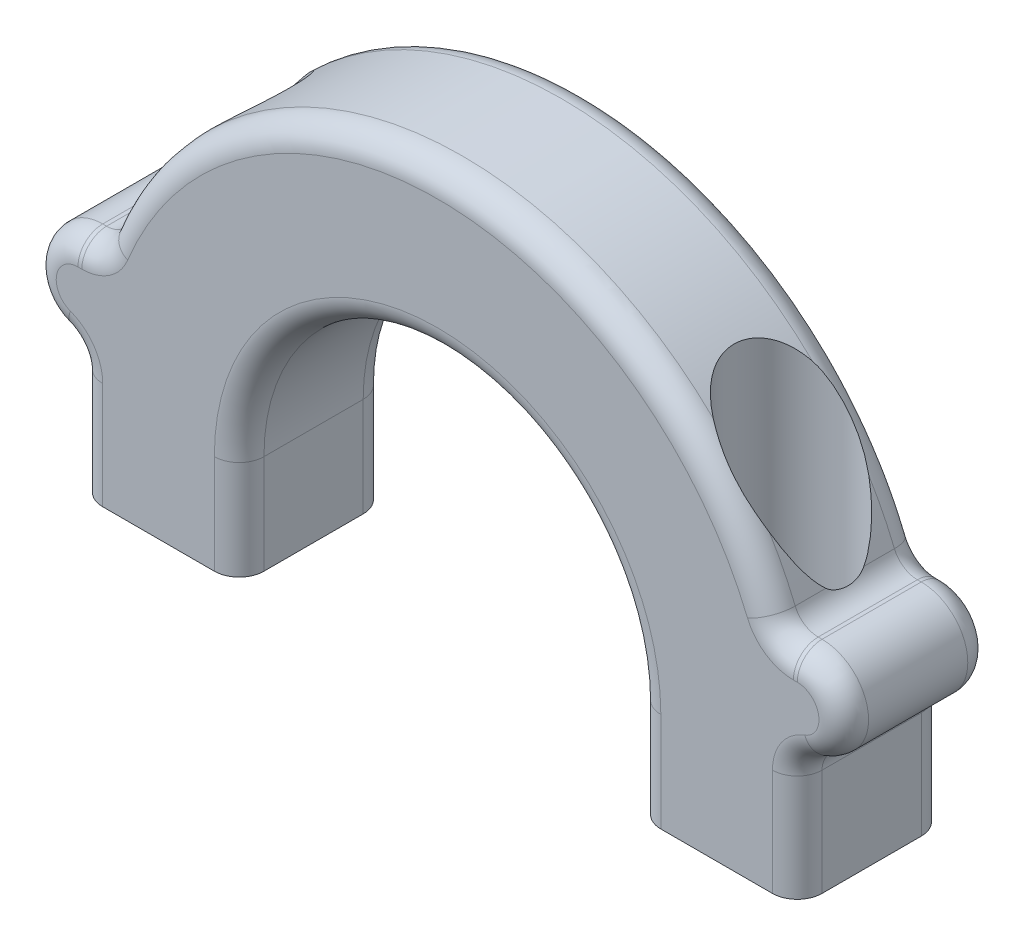
from build123d import *

# Parameters (mm, degrees)
BOSS_EXTRUDE1_DEPTH = 3.81
BOSS_EXTRUDE2_DEPTH = 7.62
FILLET2_R           = 1.27
FILLET1_R           = 1.27


with BuildPart() as part:
    # Sketch1 → Boss-Extrude1 (new, symmetric)
    with BuildSketch(Plane.XY):
        with BuildLine():
            Line((-10.16, 0), (-10.16, 5.08))
            ThreePointArc((-10.16, 5.08), (0, 15.24), (10.16, 5.08))
            Line((10.16, 5.08), (10.16, 0))
            Line((10.16, 0), (18.415, 0))
            Line((18.415, 0), (18.415, 5.08))
            ThreePointArc((18.415, 5.08), (0, 23.495), (-18.415, 5.08))
            Line((-18.415, 5.08), (-18.415, 0))
            Line((-18.415, 0), (-10.16, 0))
        make_face()
    extrude(amount=BOSS_EXTRUDE1_DEPTH, both=True)

    # Sketch5 → Boss-Extrude2 (add)
    with BuildSketch(Plane.XY.offset(3.81)):
        with BuildLine():
            Line((-18.415, 6.50875), (-18.415, 5.08))
            Line((-18.415, 5.08), (-15.329283607, 5.08))
            Line((-15.329283607, 5.08), (-15.329283607, 11.27125))
            Line((-15.329283607, 11.27125), (-18.415, 11.27125))
            ThreePointArc((-18.415, 11.27125), (-20.79625, 8.89), (-18.415, 6.50875))
        make_face()
    boss_extrude2 = extrude(amount=-BOSS_EXTRUDE2_DEPTH)

    # Sketch3 → Cut-Revolve3 (revolve, cut)
    with BuildSketch(Plane.XY, mode=Mode.PRIVATE) as cut_revolve3_sk:
        Polygon((-14.2875, 0), (-14.2875, 21.486225754), (-17.2085, 21.486225754), (-17.2085, 6.35), (-15.9385, 6.35), (-15.9385, 0), align=None)
    cut_revolve3 = revolve(cut_revolve3_sk.sketch.rotate(Axis((-14.2875, 0, 0), (0, -1, 0)), 270), axis=Axis((-14.2875, 0, 0), (0, -1, 0)), mode=Mode.SUBTRACT)

    # Mirror1: Boss-Extrude2, Cut-Revolve3 across plane
    add(boss_extrude2.mirror(Plane(origin=(0, 0, 0), x_dir=(0, 0, 1), z_dir=(1, 0, 0))))
    add(cut_revolve3.mirror(Plane(origin=(0, 0, 0), x_dir=(0, 0, 1), z_dir=(1, 0, 0))), mode=Mode.SUBTRACT)

    # Fillet2
    # the kernel refuses this fillet: 1.27 mm, written as the material it adds along each edge
    with BuildSketch(Plane(origin=(18.415, 6.50875, 3.81), x_dir=(0, -1, 0), z_dir=(0, 0, -1))) as fillet2_piece_1:
        with BuildLine():
            CenterArc((1.042012561, -1.27), FILLET2_R, 90, 69.645593602)
            ThreePointArc((-0.14868746, -0.82826087), (-0.037466615, -0.420750528), (0, 0))
            Line((0, 0), (1.042012561, 0))
        make_face()
    extrude(amount=7.62)
    with BuildSketch(Plane(origin=(17.343028814, 11.27125, -3.81), x_dir=(1, 0, 0), z_dir=(0, 0, 1))) as fillet2_piece_2_section:
        with BuildLine():
            CenterArc((0.873144589, 1.27), FILLET2_R, 202.273751374, 67.726248626)
            ThreePointArc((-0.302092405, 0.788629032), (-0.146524807, 0.396046483), (0, 0))
            Line((0, 0), (0.873144589, 0))
        make_face()
    fillet2_piece_2 = extrude(amount=7.62, mode=Mode.PRIVATE)
    fillet2_piece_2 = fillet2_piece_2 - Plane(origin=(14.2875, 11.436472081, 0), x_dir=(0, 0, 1), z_dir=(0, -1, 0)) * Cylinder(2.921, 19, mode=Mode.PRIVATE)
    add(fillet2_piece_2)
    with BuildSketch(Plane(origin=(-18.415, 6.50875, 3.81), x_dir=(0, -1, 0), z_dir=(0, 0, -1))) as fillet2_piece_3:
        with BuildLine():
            CenterArc((1.042012561, 1.27), FILLET2_R, 200.354406398, 69.645593602)
            ThreePointArc((-0.14868746, 0.82826087), (-0.037466615, 0.420750528), (0, 0))
            Line((0, 0), (1.042012561, 0))
        make_face()
    extrude(amount=7.62)
    with BuildSketch(Plane(origin=(-17.343028814, 11.27125, -3.81), x_dir=(0.35771362925486355, 0.9338313335101335, 0), z_dir=(0, 0, 1))) as fillet2_piece_4_section:
        with BuildLine():
            CenterArc((0.873630074, 1.269666085), FILLET2_R, 200.959848395, 67.726248626)
            Line((-0.31233572, 0.815369776), (0, 0))
            ThreePointArc((0, 0), (0.422254536, 0.004841769), (0.844509071, 0))
        make_face()
    fillet2_piece_4 = extrude(amount=7.62, mode=Mode.PRIVATE)
    fillet2_piece_4 = fillet2_piece_4 - Plane(origin=(-14.2875, 11.436472184, 0), x_dir=(0, 0, 1), z_dir=(0, -1, 0)) * Cylinder(2.921, 19, mode=Mode.PRIVATE)
    add(fillet2_piece_4)

    # Fillet1
    # the kernel refuses this fillet: 1.27 mm, written as the material it takes off along each edge
    with BuildSketch(Plane(origin=(10.16, 5.08, -3.81), x_dir=(1, 0, 0), z_dir=(0, -1, 0)), Plane(origin=(-10.16, -3.175, -3.81), x_dir=(-1, 0, 0), z_dir=(0, 1, 0))) as fillet1_piece_1:
        with BuildLine():
            CenterArc((FILLET1_R, FILLET1_R), FILLET1_R, 180, 90)
            Line((0, FILLET1_R), (0, 0))
            Line((0, 0), (FILLET1_R, 0))
        make_face()
    extrude(amount=8.255, mode=Mode.SUBTRACT)
    with BuildSketch(Plane(origin=(0, 5.08, -3.81), x_dir=(-1, 0, 0), z_dir=(0, -1, 0))) as fillet1_piece_2:
        with BuildLine():
            CenterArc((10.16 + FILLET1_R, -FILLET1_R), FILLET1_R, 90, 90)
            Line((10.16, -FILLET1_R), (10.16, 0))
            Line((10.16, 0), (10.16 + FILLET1_R, 0))
        make_face()
    revolve(axis=Axis((0, 5.08, -3.81), (0, 0, -1)), revolution_arc=180, mode=Mode.SUBTRACT)
    with BuildSketch(Plane(origin=(0, 5.08, 3.81), x_dir=(-1, 0, 0), z_dir=(0, -1, 0))) as fillet1_piece_3:
        with BuildLine():
            CenterArc((10.16 + FILLET1_R, FILLET1_R), FILLET1_R, 180, 90)
            Line((10.16, FILLET1_R), (10.16, 0))
            Line((10.16, 0), (10.16 + FILLET1_R, 0))
        make_face()
    revolve(axis=Axis((0, 5.08, 3.81), (0, 0, -1)), revolution_arc=180, mode=Mode.SUBTRACT)
    with BuildSketch(Plane(origin=(10.16, 5.08, 3.81), x_dir=(1, 0, 0), z_dir=(0, -1, 0)), Plane(origin=(-10.16, -3.175, 3.81), x_dir=(-1, 0, 0), z_dir=(0, 1, 0))) as fillet1_piece_4:
        with BuildLine():
            CenterArc((FILLET1_R, -FILLET1_R), FILLET1_R, 90, 90)
            Line((0, -FILLET1_R), (0, 0))
            Line((0, 0), (FILLET1_R, 0))
        make_face()
    extrude(amount=8.255, mode=Mode.SUBTRACT)
    with BuildSketch(Plane(origin=(18.415, -3.175, 3.81), x_dir=(-1, 0, 0), z_dir=(0, 1, 0)), Plane(origin=(18.415, 5.466737439, -3.81), x_dir=(-1, 0, 0), z_dir=(0, -1, 0))) as fillet1_piece_5:
        with BuildLine():
            CenterArc((FILLET1_R, -FILLET1_R), FILLET1_R, 90, 90)
            Line((0, -FILLET1_R), (0, 0))
            Line((0, 0), (FILLET1_R, 0))
        make_face()
    extrude(amount=8.641737439, mode=Mode.SUBTRACT)
    with BuildSketch(Plane(origin=(-18.415, 8.89, 3.81), x_dir=(0, 1, 0), z_dir=(1, 0, 0))) as fillet1_piece_6:
        with BuildLine():
            CenterArc((2.38125 - FILLET1_R, -FILLET1_R), FILLET1_R, 0, 90)
            Line((2.38125, -FILLET1_R), (2.38125, 0))
            Line((2.38125, 0), (2.38125 - FILLET1_R, 0))
        make_face()
    revolve(axis=Axis((-18.415, 8.89, 3.81), (0, 0, 1)), revolution_arc=159.645593602, mode=Mode.SUBTRACT)
    with BuildSketch(Plane(origin=(-18.415, 8.89, -3.81), x_dir=(0, 1, 0), z_dir=(1, 0, 0))) as fillet1_piece_7:
        with BuildLine():
            CenterArc((2.38125 - FILLET1_R, FILLET1_R), FILLET1_R, 270, 90)
            Line((2.38125, FILLET1_R), (2.38125, 0))
            Line((2.38125, 0), (2.38125 - FILLET1_R, 0))
        make_face()
    revolve(axis=Axis((-18.415, 8.89, -3.81), (0, 0, 1)), revolution_arc=159.645593602, mode=Mode.SUBTRACT)
    with BuildSketch(Plane(origin=(18.415, 8.89, 3.81), x_dir=(0, 1, 0), z_dir=(-1, 0, 0))) as fillet1_piece_8:
        with BuildLine():
            CenterArc((2.38125 - FILLET1_R, FILLET1_R), FILLET1_R, 270, 90)
            Line((2.38125, FILLET1_R), (2.38125, 0))
            Line((2.38125, 0), (2.38125 - FILLET1_R, 0))
        make_face()
    revolve(axis=Axis((18.415, 8.89, 3.81), (0, 0, -1)), revolution_arc=159.645593602, mode=Mode.SUBTRACT)
    with BuildSketch(Plane(origin=(18.415, 8.89, -3.81), x_dir=(0, 1, 0), z_dir=(-1, 0, 0))) as fillet1_piece_9:
        with BuildLine():
            CenterArc((2.38125 - FILLET1_R, -FILLET1_R), FILLET1_R, 0, 90)
            Line((2.38125, -FILLET1_R), (2.38125, 0))
            Line((2.38125, 0), (2.38125 - FILLET1_R, 0))
        make_face()
    revolve(axis=Axis((18.415, 8.89, -3.81), (0, 0, -1)), revolution_arc=159.645593602, mode=Mode.SUBTRACT)
    with BuildSketch(Plane(origin=(18.216173403, 11.27125, -3.81), x_dir=(0, -1, 0), z_dir=(1, 0, 0)), Plane(origin=(-18.216173403, 11.27125, 3.81), x_dir=(0, -1, 0), z_dir=(-1, 0, 0))) as fillet1_piece_10:
        with BuildLine():
            CenterArc((FILLET1_R, -FILLET1_R), FILLET1_R, 90, 90)
            Line((0, -FILLET1_R), (0, 0))
            Line((0, 0), (FILLET1_R, 0))
        make_face()
    extrude(amount=0.198826597, mode=Mode.SUBTRACT)
    with BuildSketch(Plane(origin=(18.216173403, 11.27125, 3.81), x_dir=(0, -1, 0), z_dir=(1, 0, 0)), Plane(origin=(-18.216173403, 11.27125, -3.81), x_dir=(0, -1, 0), z_dir=(-1, 0, 0))) as fillet1_piece_11:
        with BuildLine():
            CenterArc((FILLET1_R, FILLET1_R), FILLET1_R, 180, 90)
            Line((0, FILLET1_R), (0, 0))
            Line((0, 0), (FILLET1_R, 0))
        make_face()
    extrude(amount=0.198826597, mode=Mode.SUBTRACT)
    with BuildSketch(Plane(origin=(0, 5.08, -3.81), x_dir=(0.9253834596244552, 0.3790322580645007, 0), z_dir=(0.3790322580645007, -0.9253834596244552, 0))) as fillet1_piece_12:
        with BuildLine():
            CenterArc((18.415 - FILLET1_R, FILLET1_R), FILLET1_R, 270, 90)
            Line((18.415, FILLET1_R), (18.415, 0))
            Line((18.415, 0), (18.415 - FILLET1_R, 0))
        make_face()
    revolve(axis=Axis((0, 5.08, -3.81), (0, 0, 1)), revolution_arc=135.452497253, mode=Mode.SUBTRACT)
    with BuildSketch(Plane(origin=(0, 5.08, 3.81), x_dir=(0.9253834596244552, 0.3790322580645007, 0), z_dir=(0.3790322580645007, -0.9253834596244552, 0))) as fillet1_piece_13:
        with BuildLine():
            CenterArc((18.415 - FILLET1_R, -FILLET1_R), FILLET1_R, 0, 90)
            Line((18.415 - FILLET1_R, 0), (18.415, 0))
            Line((18.415, 0), (18.415, -FILLET1_R))
        make_face()
    revolve(axis=Axis((0, 5.08, 3.81), (0, 0, 1)), revolution_arc=135.452497253, mode=Mode.SUBTRACT)
    with BuildSketch(Plane(origin=(-18.415, 5.466737439, -3.81), x_dir=(1, 0, 0), z_dir=(0, -1, 0)), Plane(origin=(-18.415, -3.175, 3.81), x_dir=(1, 0, 0), z_dir=(0, 1, 0))) as fillet1_piece_14:
        with BuildLine():
            CenterArc((FILLET1_R, FILLET1_R), FILLET1_R, 180, 90)
            Line((0, FILLET1_R), (0, 0))
            Line((0, 0), (FILLET1_R, 0))
        make_face()
    extrude(amount=8.641737439, mode=Mode.SUBTRACT)
    with BuildSketch(Plane(origin=(19.685, 5.466737439, 3.81), x_dir=(-1, 0, 0), z_dir=(0, -1, 0))) as fillet1_piece_15:
        with BuildLine():
            CenterArc((1.27 + FILLET1_R, FILLET1_R), FILLET1_R, 180, 90)
            Line((1.27, FILLET1_R), (1.27, 0))
            Line((1.27, 0), (1.27 + FILLET1_R, 0))
        make_face()
    revolve(axis=Axis((19.685, 5.466737439, 3.81), (0, 0, -1)), revolution_arc=69.645593602, mode=Mode.SUBTRACT)
    with BuildSketch(Plane(origin=(19.685, 5.466737439, -3.81), x_dir=(-1, 0, 0), z_dir=(0, -1, 0))) as fillet1_piece_16:
        with BuildLine():
            CenterArc((1.27 + FILLET1_R, -FILLET1_R), FILLET1_R, 90, 90)
            Line((1.27, -FILLET1_R), (1.27, 0))
            Line((1.27, 0), (1.27 + FILLET1_R, 0))
        make_face()
    revolve(axis=Axis((19.685, 5.466737439, -3.81), (0, 0, -1)), revolution_arc=69.645593602, mode=Mode.SUBTRACT)
    with BuildSketch(Plane(origin=(18.216173403, 12.54125, 3.81), x_dir=(-0.9253834596244525, -0.3790322580645073, 0), z_dir=(-0.3790322580645073, 0.9253834596244525, 0))) as fillet1_piece_17:
        with BuildLine():
            CenterArc((1.27 + FILLET1_R, -FILLET1_R), FILLET1_R, 90, 90)
            Line((1.27, -FILLET1_R), (1.27, 0))
            Line((1.27, 0), (1.27 + FILLET1_R, 0))
        make_face()
    revolve(axis=Axis((18.216173403, 12.54125, 3.81), (0, 0, 1)), revolution_arc=67.726248626, mode=Mode.SUBTRACT)
    with BuildSketch(Plane(origin=(18.216173403, 12.54125, -3.81), x_dir=(-0.9253834596244525, -0.3790322580645073, 0), z_dir=(-0.3790322580645073, 0.9253834596244525, 0))) as fillet1_piece_18:
        with BuildLine():
            CenterArc((1.27 + FILLET1_R, FILLET1_R), FILLET1_R, 180, 90)
            Line((1.27, FILLET1_R), (1.27, 0))
            Line((1.27, 0), (1.27 + FILLET1_R, 0))
        make_face()
    revolve(axis=Axis((18.216173403, 12.54125, -3.81), (0, 0, 1)), revolution_arc=67.726248626, mode=Mode.SUBTRACT)
    with BuildSketch(Plane(origin=(-19.685, 5.466737439, 3.81), x_dir=(0.3478260869565167, 0.9375590718629507, 0), z_dir=(-0.9375590718629507, 0.3478260869565167, 0))) as fillet1_piece_19:
        with BuildLine():
            CenterArc((1.27 + FILLET1_R, FILLET1_R), FILLET1_R, 180, 90)
            Line((1.27, FILLET1_R), (1.27, 0))
            Line((1.27, 0), (1.27 + FILLET1_R, 0))
        make_face()
    revolve(axis=Axis((-19.685, 5.466737439, 3.81), (0, 0, -1)), revolution_arc=69.645593602, mode=Mode.SUBTRACT)
    with BuildSketch(Plane(origin=(-19.685, 5.466737439, -3.81), x_dir=(0.3478260869565167, 0.9375590718629507, 0), z_dir=(-0.9375590718629507, 0.3478260869565167, 0))) as fillet1_piece_20:
        with BuildLine():
            CenterArc((1.27 + FILLET1_R, -FILLET1_R), FILLET1_R, 90, 90)
            Line((1.27, -FILLET1_R), (1.27, 0))
            Line((1.27, 0), (1.27 + FILLET1_R, 0))
        make_face()
    revolve(axis=Axis((-19.685, 5.466737439, -3.81), (0, 0, -1)), revolution_arc=69.645593602, mode=Mode.SUBTRACT)
    with BuildSketch(Plane(origin=(-18.216173403, 12.54125, 3.81), x_dir=(0, -1, 0), z_dir=(-1, 0, 0))) as fillet1_piece_21:
        with BuildLine():
            CenterArc((1.27 + FILLET1_R, -FILLET1_R), FILLET1_R, 90, 90)
            Line((1.27 + FILLET1_R, 0), (1.27, 0))
            Line((1.27, 0), (1.27, -FILLET1_R))
        make_face()
    revolve(axis=Axis((-18.216173403, 12.54125, 3.81), (0, 0, 1)), revolution_arc=67.726248626, mode=Mode.SUBTRACT)
    with BuildSketch(Plane(origin=(-18.216173403, 12.54125, -3.81), x_dir=(0, -1, 0), z_dir=(-1, 0, 0))) as fillet1_piece_22:
        with BuildLine():
            CenterArc((1.27 + FILLET1_R, FILLET1_R), FILLET1_R, 180, 90)
            Line((1.27 + FILLET1_R, 0), (1.27, 0))
            Line((1.27, 0), (1.27, FILLET1_R))
        make_face()
    revolve(axis=Axis((-18.216173403, 12.54125, -3.81), (0, 0, 1)), revolution_arc=67.726248626, mode=Mode.SUBTRACT)


solid = part.part
